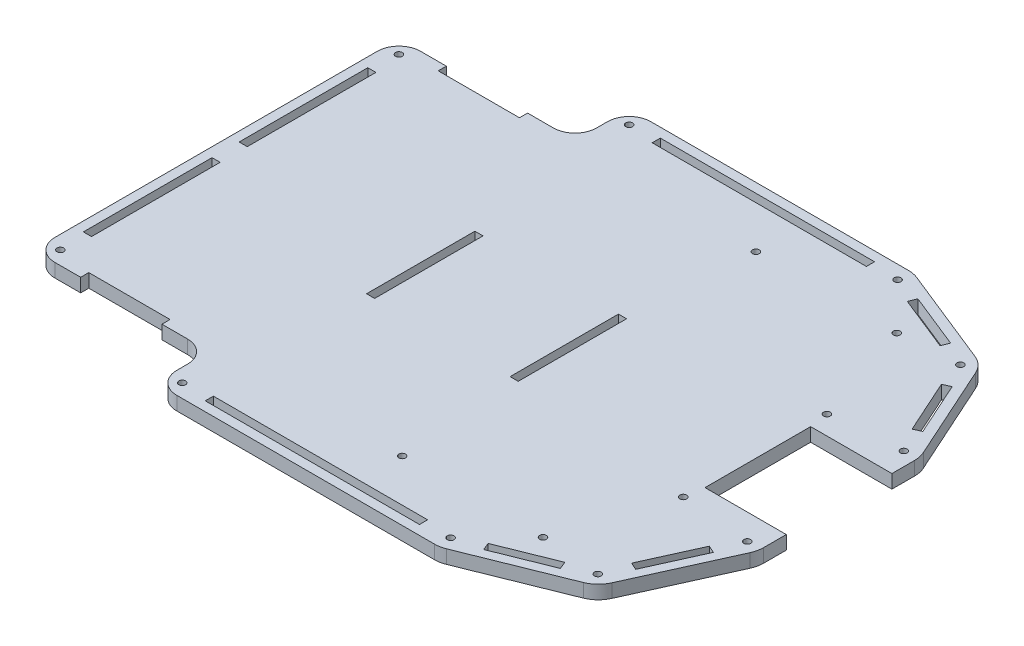
from build123d import *

# Parameters (mm, degrees)
ESTRUSIONE_ESTRUSIONE1_DEPTH  = 5
FORO_FILETTATO_M3X0_5_1_D     = 2.5
FORO_FILETTATO_M3X0_5_1_DEPTH = 7.5
FORO_FILETTATO_M3X0_5_1_TIP   = 0.751075774
SCHIZZO26_W                   = 30
SCHIZZO26_H                   = 3
TAGLIO_ESTRUSIONE12_DEPTH     = 10
SCHIZZO4_W                    = 79.084596206
SCHIZZO4_H                    = 3
TAGLIO_ESTRUSIONE2_DEPTH      = 10
SCHIZZO7_W                    = 3
SCHIZZO7_H                    = 47.5
TAGLIO_ESTRUSIONE5_DEPTH      = 10
SCHIZZO12_W                   = 3
SCHIZZO12_H                   = 40
TAGLIO_ESTRUSIONE8_DEPTH      = 247.132586221
TAGLIO_ESTRUSIONE1_DEPTH      = 247.132586221
TAGLIO_ESTRUSIONE1_DEPTH_BACK = 247.132586221
FORO_FILETTATO_M3X0_5_4_D     = 2.5
FORO_FILETTATO_M3X0_5_5_D     = 2.5
RACCORDO1_R                   = 8
RACCORDO2_R                   = 10


with BuildPart() as part:
    # Schizzo1 → Estrusione-Estrusione1 (new body)
    with BuildSketch(Plane(origin=(0, 0, 0), x_dir=(1, 0, 0), z_dir=(0, 1, 0))):
        Polygon((65, 67.5), (65, 87.5), (170.052105959, 87.5), (211.585225273, 70.801270189), (230, 30), (230, -30), (211.585225273, -70.801270189), (170.052105959, -87.5), (65, -87.5), (65, -67.5), (0, -67.5), (0, 67.5), align=None)
    extrude(amount=ESTRUSIONE_ESTRUSIONE1_DEPTH)

    # Foro filettato M3x0.5-1
    with Locations(Plane(origin=(0, 5, 0), x_dir=(1, 0, 0), z_dir=(0, 1, 0))):
        with Locations((207.854862265, 66.912097904), (225, 28.92393853), (225, -28.92393853), (207.854862265, -66.912097904), (169.084596206, -82.5), (169.084596206, 82.5), (70, 82.5), (70, -82.5), (5, -62.5), (5, 62.5)):
            Hole(FORO_FILETTATO_M3X0_5_1_D / 2, depth=FORO_FILETTATO_M3X0_5_1_DEPTH)
            with Locations((0, 0, -(FORO_FILETTATO_M3X0_5_1_DEPTH + FORO_FILETTATO_M3X0_5_1_TIP / 2))):  # 118° drill point
                Cone(0, FORO_FILETTATO_M3X0_5_1_D / 2, FORO_FILETTATO_M3X0_5_1_TIP, mode=Mode.SUBTRACT)

    # Schizzo26 → Taglio-Estrusione12 (cut)
    with BuildSketch(Plane(origin=(0, 5, 0), x_dir=(1, 0, 0), z_dir=(0, 1, 0))):
        with Locations((32.5, -66)):
            Rectangle(SCHIZZO26_W, SCHIZZO26_H)
    taglio_estrusione12 = extrude(amount=-TAGLIO_ESTRUSIONE12_DEPTH, mode=Mode.SUBTRACT)

    # Specchia1: Taglio-Estrusione12 across plane
    add(taglio_estrusione12.mirror(Plane.XY), mode=Mode.SUBTRACT)

    # Schizzo4 → Taglio-Estrusione2 (cut)
    with BuildSketch(Plane(origin=(0, 5, 0), x_dir=(1, 0, 0), z_dir=(0, 1, 0))):
        with Locations((119.542298103, -82.5)):
            Rectangle(SCHIZZO4_W, SCHIZZO4_H)
        Polygon((219.519084515, 37.421559693), (210.601374282, 57.180362615), (213.33577775, 58.414476741), (222.253487983, 38.655673819), align=None)
        with Locations((119.542298103, 82.5)):
            Rectangle(SCHIZZO4_W, SCHIZZO4_H)
        Polygon((199.136249234, 72.034186035), (178.92231814, 80.161362114), (177.803209237, 77.377911869), (198.017140331, 69.250735791), align=None)
        Polygon((177.803209237, -77.377911869), (198.017140331, -69.250735791), (199.136249234, -72.034186035), (178.92231814, -80.161362114), align=None)
        Polygon((210.601374282, -57.180362615), (219.519084515, -37.421559693), (222.253487983, -38.655673819), (213.33577775, -58.414476741), align=None)
    extrude(amount=-TAGLIO_ESTRUSIONE2_DEPTH, mode=Mode.SUBTRACT)

    # Schizzo7 → Taglio-Estrusione5 (cut)
    with BuildSketch(Plane(origin=(0, 5, 0), x_dir=(1, 0, 0), z_dir=(0, 1, 0))):
        with Locations((5, 28.75)):
            Rectangle(SCHIZZO7_W, SCHIZZO7_H)
        with Locations((5, -28.75)):
            Rectangle(SCHIZZO7_W, SCHIZZO7_H)
    extrude(amount=-TAGLIO_ESTRUSIONE5_DEPTH, mode=Mode.SUBTRACT)

    # Schizzo12 → Taglio-Estrusione8 (cut, through all)
    with BuildSketch(Plane(origin=(0, 5, 0), x_dir=(1, 0, 0), z_dir=(0, 1, 0))):
        with Locations((77.042298103, 0)):
            Rectangle(SCHIZZO12_W, SCHIZZO12_H)
        with Locations((130.042298103, 0)):
            Rectangle(SCHIZZO12_W, SCHIZZO12_H)
    extrude(amount=-TAGLIO_ESTRUSIONE8_DEPTH, mode=Mode.SUBTRACT)

    # Schizzo2 → Taglio-Estrusione1 (cut, two sides: drawn at the far end of the back side and taken through both)
    with BuildSketch(Plane(origin=(0, 5, 0), x_dir=(1, 0, 0), z_dir=(0, 1, 0)).offset(-TAGLIO_ESTRUSIONE1_DEPTH_BACK)):
        Polygon((747.342093661, 19.5), (230, 19.5), (200, 19.5), (200, -19.5), (230, -19.5), (747.342093661, -19.5), (1782.026280982, -19.5), (1782.026280982, 19.5), align=None)
    extrude(amount=TAGLIO_ESTRUSIONE1_DEPTH + TAGLIO_ESTRUSIONE1_DEPTH_BACK, mode=Mode.SUBTRACT)

    # Foro filettato M3x0.5-4 (through all)
    with Locations(Plane(origin=(0, 5, 0), x_dir=(1, 0, 0), z_dir=(0, 1, 0))):
        with Locations((199, 26.5), (199, -26.5)):
            Hole(FORO_FILETTATO_M3X0_5_4_D / 2)

    # Foro filettato M3x0.5-5 (through all)
    with Locations(Plane(origin=(0, 5, 0), x_dir=(1, 0, 0), z_dir=(0, 1, 0))):
        with Locations((133.986816105, 65.3), (185.986816105, 65.3), (185.986816105, -65.3), (133.986816105, -65.3)):
            Hole(FORO_FILETTATO_M3X0_5_5_D / 2)

    # Raccordo1
    raccordo1_edges = [part.edges().sort_by_distance(p)[0] for p in [
        (0, 2.5, 67.5),
        (0, 2.5, -67.5),
        (65, 2.5, -87.5),
        (65, 2.5, 87.5),
        (65, 2.5, 67.5),
        (65, 2.5, -67.5),
    ]]
    fillet(raccordo1_edges, radius=RACCORDO1_R)

    # Raccordo2
    raccordo2_edges = [part.edges().sort_by_distance(p)[0] for p in [
        (170.052105959, 2.5, -87.5),
        (211.585225273, 2.5, -70.801270189),
        (230, 2.5, -30),
        (230, 2.5, 30),
        (211.585225273, 2.5, 70.801270189),
        (170.052105959, 2.5, 87.5),
    ]]
    fillet(raccordo2_edges, radius=RACCORDO2_R)


solid = part.part
